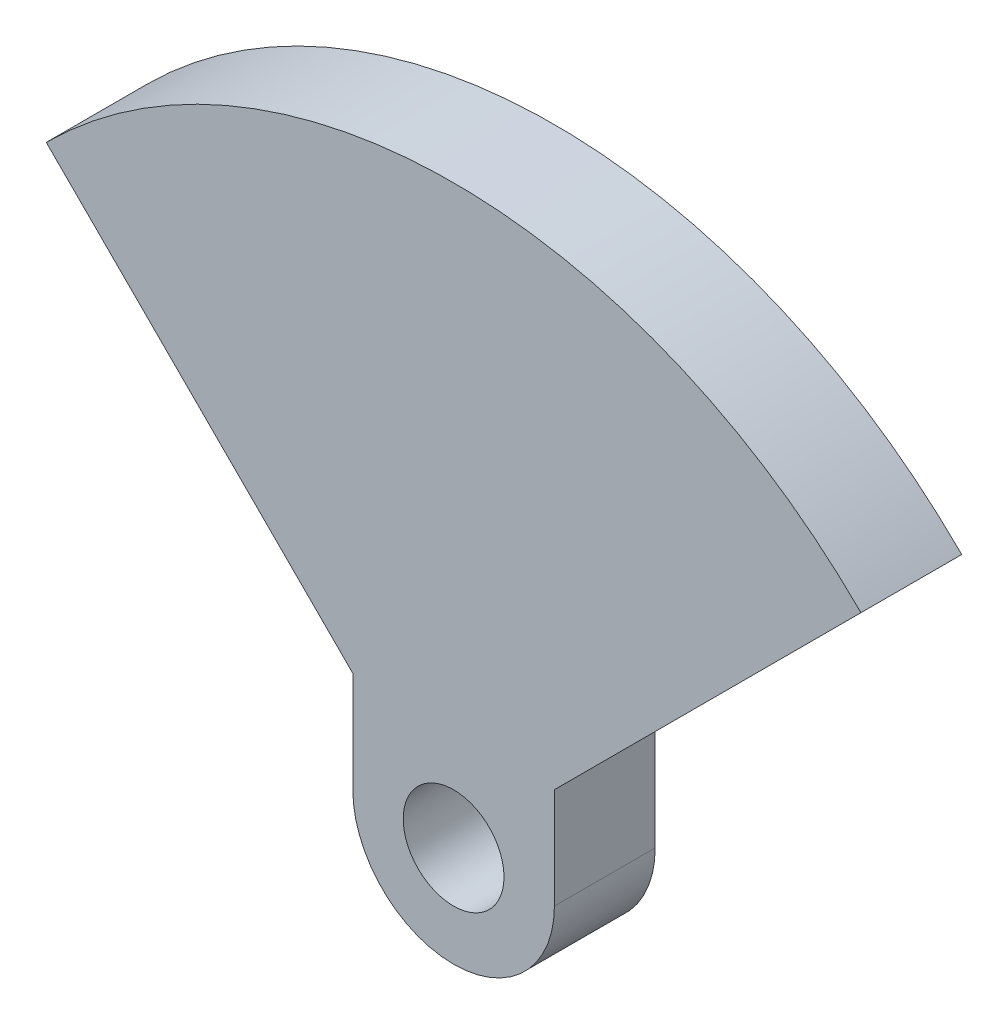
from build123d import *

# Parameters (mm, degrees)
BOSS_EXTRUDE1_DEPTH = 5.999999938


with BuildPart() as part:
    # Sketch1 → Boss-Extrude1 (new body)
    with BuildSketch(Plane.XY):
        with BuildLine():
            Line((-5.999999938, 5.999999938), (-5.999999938, 0))
            ThreePointArc((-5.999999938, 0), (0, -5.999999938), (5.999999938, 0))
            Line((5.999999938, 0), (5.999999938, 5.999999938))
            Line((5.999999938, 5.999999938), (24.246691527, 24.246691527))
            ThreePointArc((24.246691527, 24.246691527), (0, 34.29), (-24.246691527, 24.246691527))
            Line((-24.246691527, 24.246691527), (-5.999999938, 5.999999938))
        make_face()
        with BuildLine():
            ThreePointArc((2.999999969, 0), (-1.148050285, -2.771638569), (-2.121320322, 2.121320322))
            ThreePointArc((-2.121320322, 2.121320322), (0, 2.999999969), (2.121320322, 2.121320322))
            ThreePointArc((2.121320322, 2.121320322), (2.771638569, 1.148050285), (2.999999969, 0))
        make_face(mode=Mode.SUBTRACT)
    extrude(amount=BOSS_EXTRUDE1_DEPTH)


solid = part.part
